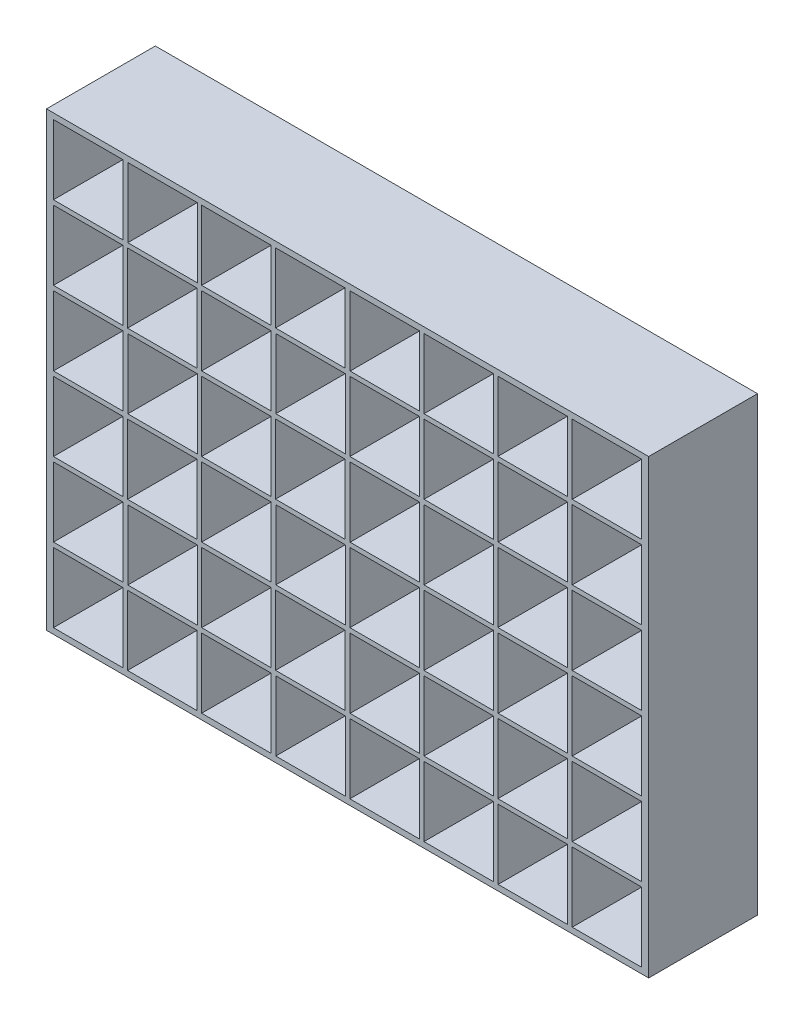
from build123d import *

# Parameters (mm, degrees)
SKETCH2_W           = 520
SKETCH2_H           = 390
SKETCH2_W_2         = 60
SKETCH2_H_2         = 60
BOSS_EXTRUDE1_DEPTH = 90
SKETCH5_W           = 520
SKETCH5_H           = 390
BOSS_EXTRUDE3_DEPTH = 4


with BuildPart() as part:
    # Sketch2 → Boss-Extrude1 (new body)
    with BuildSketch(Plane.XY):
        Rectangle(SKETCH2_W, SKETCH2_H)
        with Locations((224, 32)):
            Rectangle(SKETCH2_W_2, SKETCH2_H_2, mode=Mode.SUBTRACT)
        with Locations((32.19589717, 32)):
            Rectangle(SKETCH2_W_2, SKETCH2_H_2, mode=Mode.SUBTRACT)
        with Locations((96, 32)):
            Rectangle(SKETCH2_W_2, SKETCH2_H_2, mode=Mode.SUBTRACT)
        with Locations((159.80410283, 32)):
            Rectangle(SKETCH2_W_2, SKETCH2_H_2, mode=Mode.SUBTRACT)
        with Locations((-32.19589717, 32)):
            Rectangle(SKETCH2_W_2, SKETCH2_H_2, mode=Mode.SUBTRACT)
        with Locations((-159.80410283, 32)):
            Rectangle(SKETCH2_W_2, SKETCH2_H_2, mode=Mode.SUBTRACT)
        with Locations((-96, 32)):
            Rectangle(SKETCH2_W_2, SKETCH2_H_2, mode=Mode.SUBTRACT)
        with Locations((-224, 32)):
            Rectangle(SKETCH2_W_2, SKETCH2_H_2, mode=Mode.SUBTRACT)
        with Locations((-224, 160)):
            Rectangle(SKETCH2_W_2, SKETCH2_H_2, mode=Mode.SUBTRACT)
        with Locations((-159.80410283, 160)):
            Rectangle(SKETCH2_W_2, SKETCH2_H_2, mode=Mode.SUBTRACT)
        with Locations((-96, 160)):
            Rectangle(SKETCH2_W_2, SKETCH2_H_2, mode=Mode.SUBTRACT)
        with Locations((-32.19589717, 160)):
            Rectangle(SKETCH2_W_2, SKETCH2_H_2, mode=Mode.SUBTRACT)
        with Locations((32.19589717, 160)):
            Rectangle(SKETCH2_W_2, SKETCH2_H_2, mode=Mode.SUBTRACT)
        with Locations((96, 160)):
            Rectangle(SKETCH2_W_2, SKETCH2_H_2, mode=Mode.SUBTRACT)
        with Locations((159.80410283, 160)):
            Rectangle(SKETCH2_W_2, SKETCH2_H_2, mode=Mode.SUBTRACT)
        with Locations((224, 160)):
            Rectangle(SKETCH2_W_2, SKETCH2_H_2, mode=Mode.SUBTRACT)
        with Locations((-224, -96)):
            Rectangle(SKETCH2_W_2, SKETCH2_H_2, mode=Mode.SUBTRACT)
        with Locations((-159.80410283, -96)):
            Rectangle(SKETCH2_W_2, SKETCH2_H_2, mode=Mode.SUBTRACT)
        with Locations((-96, -96)):
            Rectangle(SKETCH2_W_2, SKETCH2_H_2, mode=Mode.SUBTRACT)
        with Locations((-32.19589717, -96)):
            Rectangle(SKETCH2_W_2, SKETCH2_H_2, mode=Mode.SUBTRACT)
        with Locations((32.19589717, -96)):
            Rectangle(SKETCH2_W_2, SKETCH2_H_2, mode=Mode.SUBTRACT)
        with Locations((96, -96)):
            Rectangle(SKETCH2_W_2, SKETCH2_H_2, mode=Mode.SUBTRACT)
        with Locations((159.80410283, -96)):
            Rectangle(SKETCH2_W_2, SKETCH2_H_2, mode=Mode.SUBTRACT)
        with Locations((224, -96)):
            Rectangle(SKETCH2_W_2, SKETCH2_H_2, mode=Mode.SUBTRACT)
        with Locations((-96, 96)):
            Rectangle(SKETCH2_W_2, SKETCH2_H_2, mode=Mode.SUBTRACT)
        with Locations((32, 96)):
            Rectangle(SKETCH2_W_2, SKETCH2_H_2, mode=Mode.SUBTRACT)
        with Locations((160, 96)):
            Rectangle(SKETCH2_W_2, SKETCH2_H_2, mode=Mode.SUBTRACT)
        with Locations((224, 96)):
            Rectangle(SKETCH2_W_2, SKETCH2_H_2, mode=Mode.SUBTRACT)
        with Locations((96, 96)):
            Rectangle(SKETCH2_W_2, SKETCH2_H_2, mode=Mode.SUBTRACT)
        with Locations((-32, 96)):
            Rectangle(SKETCH2_W_2, SKETCH2_H_2, mode=Mode.SUBTRACT)
        with Locations((-224, 96)):
            Rectangle(SKETCH2_W_2, SKETCH2_H_2, mode=Mode.SUBTRACT)
        with Locations((-160, 96)):
            Rectangle(SKETCH2_W_2, SKETCH2_H_2, mode=Mode.SUBTRACT)
        with Locations((-224, -32)):
            Rectangle(SKETCH2_W_2, SKETCH2_H_2, mode=Mode.SUBTRACT)
        with Locations((-160, -32)):
            Rectangle(SKETCH2_W_2, SKETCH2_H_2, mode=Mode.SUBTRACT)
        with Locations((-96, -32)):
            Rectangle(SKETCH2_W_2, SKETCH2_H_2, mode=Mode.SUBTRACT)
        with Locations((-32, -32)):
            Rectangle(SKETCH2_W_2, SKETCH2_H_2, mode=Mode.SUBTRACT)
        with Locations((32, -32)):
            Rectangle(SKETCH2_W_2, SKETCH2_H_2, mode=Mode.SUBTRACT)
        with Locations((96, -32)):
            Rectangle(SKETCH2_W_2, SKETCH2_H_2, mode=Mode.SUBTRACT)
        with Locations((160, -32)):
            Rectangle(SKETCH2_W_2, SKETCH2_H_2, mode=Mode.SUBTRACT)
        with Locations((224, -32)):
            Rectangle(SKETCH2_W_2, SKETCH2_H_2, mode=Mode.SUBTRACT)
        with Locations((-224, -160)):
            Rectangle(SKETCH2_W_2, SKETCH2_H_2, mode=Mode.SUBTRACT)
        with Locations((-160, -160)):
            Rectangle(SKETCH2_W_2, SKETCH2_H_2, mode=Mode.SUBTRACT)
        with Locations((-96, -160)):
            Rectangle(SKETCH2_W_2, SKETCH2_H_2, mode=Mode.SUBTRACT)
        with Locations((-32, -160)):
            Rectangle(SKETCH2_W_2, SKETCH2_H_2, mode=Mode.SUBTRACT)
        with Locations((96, -160)):
            Rectangle(SKETCH2_W_2, SKETCH2_H_2, mode=Mode.SUBTRACT)
        with Locations((160, -160)):
            Rectangle(SKETCH2_W_2, SKETCH2_H_2, mode=Mode.SUBTRACT)
        with Locations((224, -160)):
            Rectangle(SKETCH2_W_2, SKETCH2_H_2, mode=Mode.SUBTRACT)
        with Locations((32, -160)):
            Rectangle(SKETCH2_W_2, SKETCH2_H_2, mode=Mode.SUBTRACT)
    extrude(amount=BOSS_EXTRUDE1_DEPTH)

    # Sketch5 → Boss-Extrude3 (add)
    with BuildSketch(Plane(origin=(0, 0, 0), x_dir=(-1, 0, 0), z_dir=(0, 0, -1))):
        Rectangle(SKETCH5_W, SKETCH5_H)
    extrude(amount=BOSS_EXTRUDE3_DEPTH)


solid = part.part
